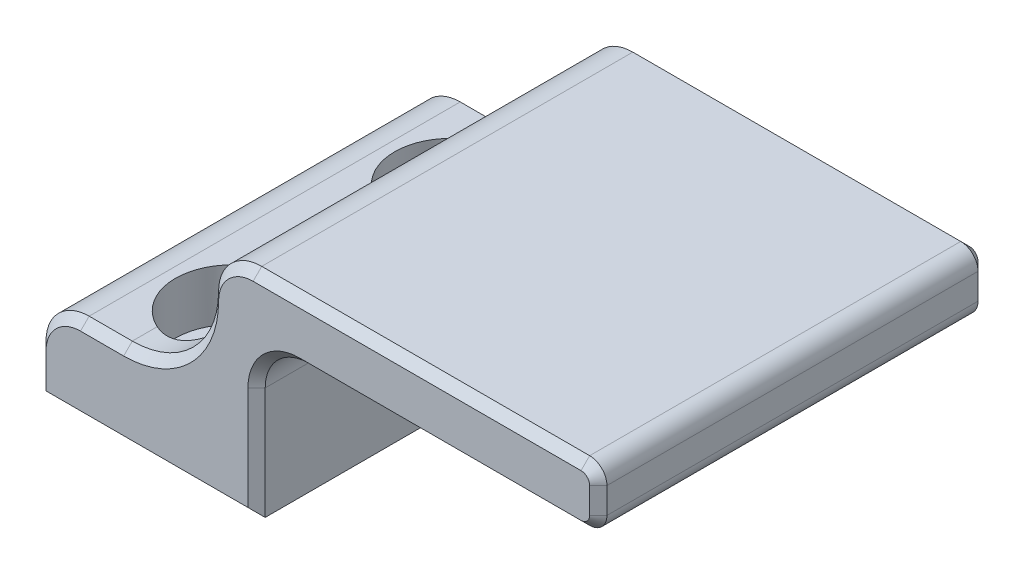
from build123d import *

# Parameters (mm, degrees)
BOSS_EXTRUDE1_DEPTH = 22.5
SKETCH3_R           = 2.921
CUT_EXTRUDE1_DEPTH  = 51.204979833
SKETCH3_4_R         = 6.5
SKETCH3_4_R_2       = 2.921
CUT_EXTRUDE2_DEPTH  = 6
FILLET1_R           = 10
FILLET2_R           = 5
FILLET4_R           = 2
CHAMFER1_SIZE       = 1


# Some blends are built 0.0001 mm under size
with BuildPart() as part:
    # Sketch1 → Boss-Extrude1 (new, symmetric)
    with BuildSketch(Plane.XY):
        Polygon((-22.7, -12.5), (2.7, -12.5), (2.7, 5.5), (42.3, 5.5), (42.3, 12.5), (-2.7, 12.5), (-2.7, -2.5), (-22.7, -2.5), align=None)
    extrude(amount=BOSS_EXTRUDE1_DEPTH, both=True)

    # Sketch3 → Cut-Extrude1 (cut, through all)
    with BuildSketch(Plane(origin=(0, -2.5, 0), x_dir=(1, 0, 0), z_dir=(0, 1, 0))):
        with Locations(Location((-10, -12.7, 0), (0, 0, 180))):
            Circle(SKETCH3_R)
    cut_extrude1 = extrude(amount=-CUT_EXTRUDE1_DEPTH, mode=Mode.SUBTRACT)

    # Sketch3<4> → Cut-Extrude2 (cut)
    with BuildSketch(Plane(origin=(0, -2.5, 0), x_dir=(1, 0, 0), z_dir=(0, 1, 0))):
        with Locations(Location((-10, -12.7, 0), (0, 0, 180))):
            Circle(SKETCH3_4_R)
        with Locations(Location((-10, -12.7, 0), (0, 0, 180))):
            Circle(SKETCH3_4_R_2, mode=Mode.SUBTRACT)
    cut_extrude2 = extrude(amount=-CUT_EXTRUDE2_DEPTH, mode=Mode.SUBTRACT)

    # Mirror1: Cut-Extrude1, Cut-Extrude2 across plane
    add(cut_extrude1.mirror(Plane.XY), mode=Mode.SUBTRACT)
    add(cut_extrude2.mirror(Plane.XY), mode=Mode.SUBTRACT)

    # Fillet1
    # the kernel refuses this fillet: 10 mm, written as the material it adds along each edge
    with BuildSketch(Plane(origin=(-2.7, -2.5, 22.5), x_dir=(0, 1, 0), z_dir=(0, 0, -1))) as fillet1_piece_1_section:
        with BuildLine():
            CenterArc((FILLET1_R, -FILLET1_R), FILLET1_R, 90, 90)
            Line((0, -FILLET1_R), (0, 0))
            Line((0, 0), (FILLET1_R, 0))
        make_face()
    fillet1_piece_1 = extrude(amount=45, mode=Mode.PRIVATE)
    fillet1_piece_1 = fillet1_piece_1 - Plane(origin=(-10, 0.155378063, -12.7), x_dir=(-1, 0, 0), z_dir=(0, 1, 0)) * Cylinder(6.5, 130, mode=Mode.PRIVATE)
    fillet1_piece_1 = fillet1_piece_1 - Plane(origin=(-10, 0.155378063, 12.7), x_dir=(-1, 0, 0), z_dir=(0, 1, 0)) * Cylinder(6.5, 130, mode=Mode.PRIVATE)
    add(fillet1_piece_1)

    # Fillet2
    fillet2_edges = [part.edges().sort_by_distance(p)[0] for p in [
        (2.7, 5.5, 0),
        (-22.7, -2.5, 0),
        (-2.7, 12.5, 0),
    ]]
    fillet(fillet2_edges, radius=FILLET2_R - 0.0001)  # a hair under: the kernel refuses the full size

    # Fillet4
    fillet4_edges = [part.edges().sort_by_distance(p)[0] for p in [
        (42.3, 12.5, 0),
        (42.3, 5.5, 0),
    ]]
    fillet(fillet4_edges, radius=FILLET4_R)

    # Chamfer1
    chamfer1_edges = [part.edges().sort_by_distance(p)[0] for p in [
        (2.7, -5.99995, -22.5),
        (-10, -12.5, -22.5),
        (2.7, -5.99995, 22.5),
        (-15.20005, -2.5, -22.5),
        (-15.20005, -2.5, 22.5),
        (-5.628932188, 0.428932188, -22.5),
        (-5.628932188, 0.428932188, 22.5),
        (-22.7, -9.99995, -22.5),
        (-22.7, -9.99995, 22.5),
        (23.99995, 5.5, -22.5),
        (-1.235563195, 11.035563195, -22.5),
        (-21.235563195, -3.964436805, -22.5),
        (23.99995, 5.5, 22.5),
        (-1.235563195, 11.035563195, 22.5),
        (-21.235563195, -3.964436805, 22.5),
        (4.164436805, 4.035563195, -22.5),
        (4.164436805, 4.035563195, 22.5),
        (21.29995, 12.5, -22.5),
        (21.29995, 12.5, 22.5),
        (42.3, 9, -22.5),
        (41.714213562, 6.085786438, -22.5),
        (41.714213562, 11.914213562, -22.5),
        (42.3, 9, 22.5),
        (41.714213562, 6.085786438, 22.5),
        (41.714213562, 11.914213562, 22.5),
        (-10, -12.5, 22.5),
    ]]
    chamfer(chamfer1_edges, length=CHAMFER1_SIZE)


solid = part.part
